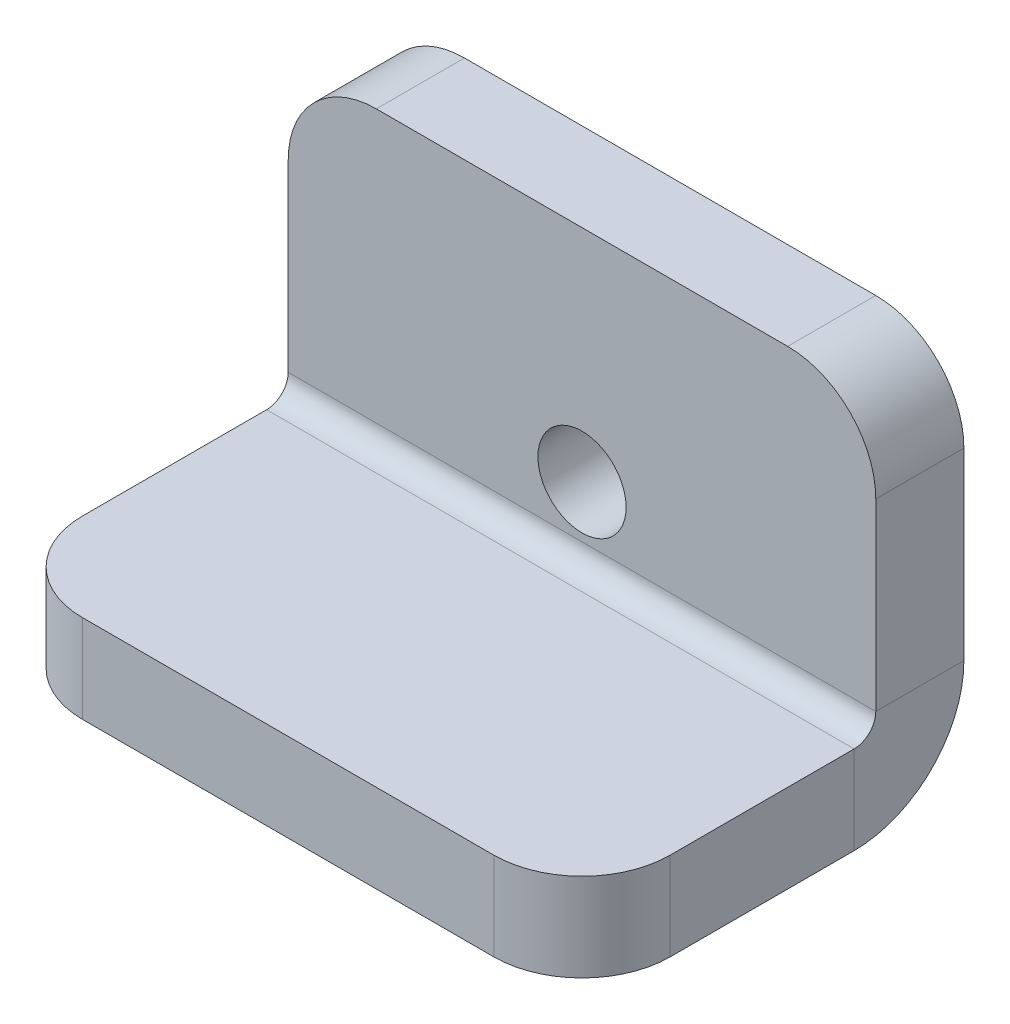
from build123d import *

# Parameters (mm, degrees)
BASE_FLANGE1_DEPTH = 20
FILLET1_R          = 3
SKETCH2_R          = 1.5
CUT_EXTRUDE1_DEPTH = 3


# Sheet-metal steps are written as plain solids
with BuildPart() as part:
    # Sketch1 → Base-Flange1 (new body)
    with BuildSketch(Plane(origin=(0, 0, 0), x_dir=(0, 0, -1), z_dir=(1, 0, 0))):
        with BuildLine():
            Line((0, 0), (9.2634, 0))
            ThreePointArc((9.2634, 0), (9.784254855, 0.215745145), (10, 0.7366))
            Line((10, 0.7366), (10, 10))
            Line((10, 10), (13, 10))
            Line((13, 10), (13, 0.7366))
            ThreePointArc((13, 0.7366), (11.905575199, -1.905575199), (9.2634, -3))
            Line((9.2634, -3), (0, -3))
            Line((0, -3), (0, 0))
        make_face()
    extrude(amount=BASE_FLANGE1_DEPTH)

    # Fillet1
    fillet1_edges = [part.edges().sort_by_distance(p)[0] for p in [
        (20, -1.5, 0),
        (20, 10, -11.5),
        (0, -1.5, 0),
        (0, 10, -11.5),
    ]]
    fillet(fillet1_edges, radius=FILLET1_R)

    # Sketch2 → Cut-Extrude1 (cut)
    with BuildSketch(Plane(origin=(0, 0, -13), x_dir=(-1, 0, 0), z_dir=(0, 0, -1))):
        with Locations((-10, 2.5)):
            Circle(SKETCH2_R)
    extrude(amount=-CUT_EXTRUDE1_DEPTH, mode=Mode.SUBTRACT)


solid = part.part
